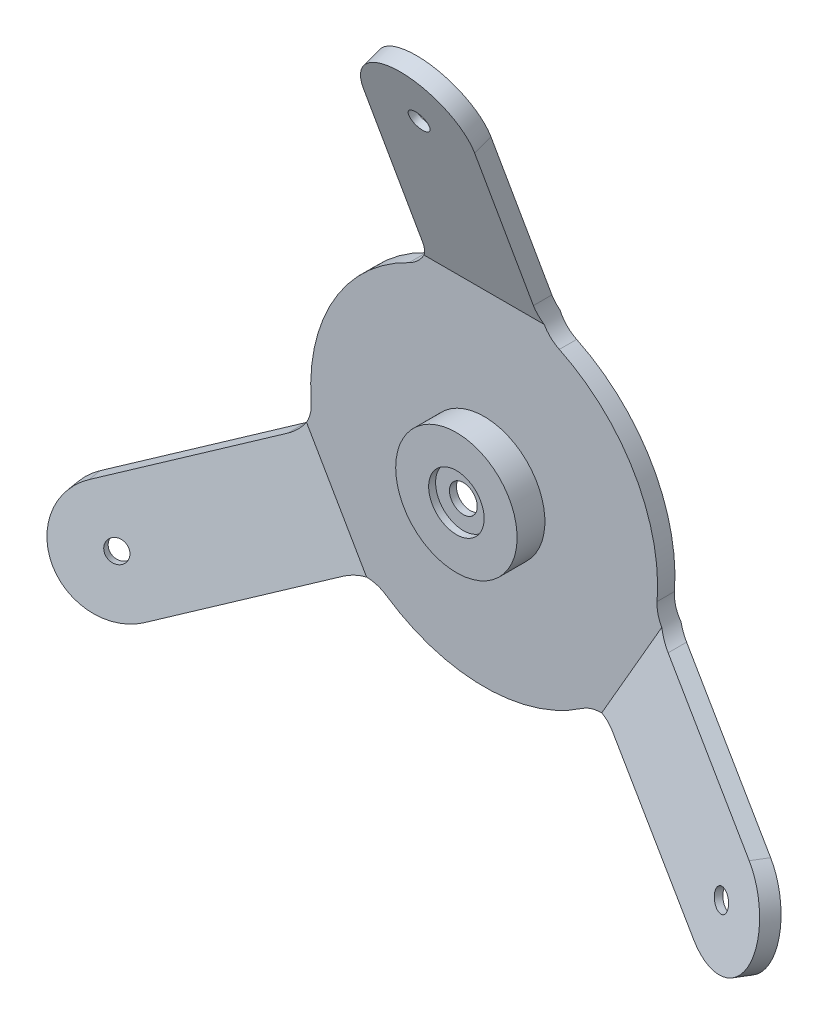
from build123d import *

# Parameters (mm, degrees)
SKETCH_1_R                       = 50
EXTRUDE_1_DEPTH                  = 5
SKETCH_1_3_R                     = 17.500000000000004
EXTRUDE_2_DEPTH                  = 13
SKETCH_2_R                       = 8
CUT_EXTRUDE_1_DEPTH              = 2
EXTRUDE_3_DEPTH                  = 5
EXTRUDE_5_REACH                  = 128.152
CUT_EXTRUDE_2_DEPTH              = 118.90068634817568
FILLET_5_R                       = 10
PATTERN_CIRCULAR_5_COUNT         = 3
FILLET_5_OF_PATTERN_CIRCULAR_5_R = 10
SHELL_1_T                        = -2
SKETCH_6_R                       = 3.000000000000001
CUT_EXTRUDE_3_DEPTH              = 159.93487100427444
PATTERN_CIRCULAR_6_COUNT         = 3
SKETCH_7_R                       = 4
CUT_EXTRUDE_4_DEPTH              = 158.79466820588078


with BuildPart() as part:
    # 草图1 → 凸台-拉伸1 (new body)
    with BuildSketch(Plane.XY):
        Circle(SKETCH_1_R)
    extrude(amount=EXTRUDE_1_DEPTH)

    # 草图1<3> → 凸台-拉伸2 (add)
    with BuildSketch(Plane.XY):
        with Locations(Location((0, 0, 0), (0, 0, 180))):
            Circle(SKETCH_1_3_R)
    extrude(amount=EXTRUDE_2_DEPTH)

    # 草图2 → 切除-拉伸1 (cut)
    with BuildSketch(Plane.XY.offset(13)):
        Circle(SKETCH_2_R)
    extrude(amount=-CUT_EXTRUDE_1_DEPTH, mode=Mode.SUBTRACT)

    # 草图3 → 凸台-拉伸3 (add)
    with BuildSketch(Plane(origin=(5.065286390387326, -2.9244444610127034, -16.069690242163254), x_dir=(-0.4547694655894244, 0.8399115425669119, -0.296198132726018), z_dir=(0.2961981327260181, -0.17101007166283297, -0.9396926207859104))):
        with BuildLine():
            Line((-48.68988406746872, 9.635909059096992), (-44.170713707432306, 7.026764835216193))
            Line((-44.170713707432306, 7.026764835216193), (-28.17071370743221, 34.73957775631811))
            Line((-28.17071370743221, 34.73957775631811), (-32.68988406746857, 37.348721980198945))
            Line((-32.68988406746857, 37.348721980198945), (-80.91104144309439, 65.18922017165217))
            ThreePointArc((-80.91104144309439, 65.18922017165217), (-102.76744790364546, 59.33281371110126), (-96.91104144309453, 37.47640725055021))
            Line((-96.91104144309453, 37.47640725055021), (-48.68988406746872, 9.635909059096992))
        make_face()
    extrude_3 = extrude(amount=-EXTRUDE_3_DEPTH)

    # 凸台-拉伸5: up to this face of the body (flat: up to its plane)
    extrude_5_end = Plane(part.part.faces().sort_by_distance((41.313007094, -23.852075767, 5))[0])
    # 草图3<3> → 凸台-拉伸5 (add, up to the picked face)
    with BuildSketch(Plane(origin=(5.065286390387326, -2.9244444610127034, -16.069690242163254), x_dir=(-0.4547694655894244, 0.8399115425669119, -0.296198132726018), z_dir=(0.2961981327260181, -0.17101007166283297, -0.9396926207859104)), mode=Mode.PRIVATE) as extrude_5_sk1:
        with BuildLine():
            Line((-48.68988406746872, 9.635909059096992), (-44.170713707432306, 7.026764835216193))
            Line((-44.170713707432306, 7.026764835216193), (-28.17071370743221, 34.73957775631811))
            Line((-28.17071370743221, 34.73957775631811), (-32.68988406746857, 37.348721980198945))
            Line((-32.68988406746857, 37.348721980198945), (-80.91104144309439, 65.18922017165217))
            ThreePointArc((-80.91104144309439, 65.18922017165217), (-102.76744790364546, 59.33281371110126), (-96.91104144309453, 37.47640725055021))
            Line((-96.91104144309453, 37.47640725055021), (-48.68988406746872, 9.635909059096992))
        make_face()
    extrude_5_tool1 = split(extrude(extrude_5_sk1.sketch, amount=-EXTRUDE_5_REACH, mode=Mode.PRIVATE), bisect_by=extrude_5_end, keep=Keep.BOTH, mode=Mode.PRIVATE)
    extrude_5 = extrude_5_tool1.solids().sort_by(Axis((69.018363, -39.847771, 10.808293), (-0.2961981327260181, 0.17101007166283297, 0.9396926207859104)))[0]
    add(extrude_5)

    # 草图5 → 切除-拉伸2 (cut, through all)
    with BuildSketch(Plane(origin=(38.49206954203913, -22.223406711762383, -1.6037e-13), x_dir=(-3.05e-15, 1.78e-15, -1), z_dir=(0.8660254037844358, -0.5000000000000049, -3.5322521134775243e-15))):
        Polygon((-1.648e-13, 16.000000000000025), (-1.5959e-13, -15.999999999999938), (1.784759762817917, -15.999999999999941), (1.7847597628179104, 16.00000000000001), align=None)
    cut_extrude_2 = extrude(amount=CUT_EXTRUDE_2_DEPTH, mode=Mode.SUBTRACT)

    # 圆角5
    # the kernel refuses this fillet: 10 mm, written as the material it adds along each edge
    with BuildSketch(Plane(origin=(49.02438299353199, -9.829032104103193, 21.757865522686952), x_dir=(0.13621517176222497, 0.9906792755386516, 2.0677653492524378e-13), z_dir=(-1.421e-14, 2.1068e-13, -1))) as fillet_5_piece_1_section:
        with BuildLine():
            CenterArc((6.731018039103729, 9.981260704815702), FILLET_5_R, 202.17110675219934, 64.32071138054346)
            Line((-2.5295920158997607, 6.207522318391934), (0, 0))
            ThreePointArc((0, 0), (3.059553654138056, 0.09369647592149925), (6.119107308276114, -4e-17))
        make_face()
    fillet_5_piece_1 = extrude(amount=21.757865522686952, mode=Mode.PRIVATE)
    fillet_5_piece_1 = split(fillet_5_piece_1, bisect_by=Plane(origin=(52.84730831811883, -11.940665679476957, 5), z_dir=(0, 0, 1)), keep=Keep.TOP, mode=Mode.PRIVATE)
    fillet_5_piece_1 = split(fillet_5_piece_1, bisect_by=Plane(origin=(52.714644452393756, -11.864072160888846, 5.897511373073815), z_dir=(0.2961981327260181, -0.17101007166283302, -0.9396926207859104)), keep=Keep.TOP, mode=Mode.PRIVATE)
    add(fillet_5_piece_1)
    with BuildSketch(Plane(origin=(49.02438299353206, -9.829032104104291, 5), x_dir=(0.13621517176219033, 0.9906792755386564, 2.067765349252453e-13), z_dir=(-1.421e-14, 2.1068e-13, -1))) as fillet_5_piece_2_section:
        with BuildLine():
            CenterArc((6.731018039104405, 9.981260704815725), FILLET_5_R, 202.17110675220147, 64.32071138054334)
            Line((-2.5295920158989453, 6.20752231839161), (0, 0))
            ThreePointArc((0, 0), (3.059553654138554, 0.09369647592138662), (6.119107308277147, 7e-17))
        make_face()
    fillet_5_piece_2 = extrude(amount=5, mode=Mode.PRIVATE)
    fillet_5_piece_2 = split(fillet_5_piece_2, bisect_by=Plane(origin=(49.82758960271088, -7.64578575322723, 4.219824774764975), z_dir=(-0.2961981327260181, 0.17101007166283302, 0.9396926207859104)), keep=Keep.TOP, mode=Mode.PRIVATE)
    add(fillet_5_piece_2)
    with BuildSketch(Plane(origin=(49.02438299353206, -9.829032104104291, 5), x_dir=(0.13621517176219033, 0.9906792755386564, 2.067765349252453e-13), z_dir=(-1.421e-14, 2.1068e-13, -1))) as fillet_5_piece_3_section:
        with BuildLine():
            CenterArc((6.731018039104405, 9.981260704815725), FILLET_5_R, 202.17110675220147, 64.32071138054334)
            Line((-2.5295920158989453, 6.20752231839161), (0, 0))
            ThreePointArc((0, 0), (3.059553654138554, 0.09369647592138662), (6.119107308277147, 7e-17))
        make_face()
    fillet_5_piece_3 = extrude(amount=5, mode=Mode.PRIVATE)
    fillet_5_piece_3 = split(fillet_5_piece_3, bisect_by=Plane(origin=(51.376248958655296, -9.84493274720883, -0.2127030682430071), z_dir=(-0.2961981327260181, 0.17101007166283302, 0.9396926207859104)), keep=Keep.TOP, mode=Mode.PRIVATE)
    fillet_5_piece_3 = split(fillet_5_piece_3, bisect_by=Plane(origin=(49.8952582950252, -8.98988238889466, 4.485760035686546), z_dir=(0.2961981327260181, -0.17101007166283302, -0.9396926207859104)), keep=Keep.TOP, mode=Mode.PRIVATE)
    add(fillet_5_piece_3)
    with BuildSketch(Plane(origin=(33.02438299353184, -37.54184502520521, 0), x_dir=(-0.7898458337381293, -0.6133054368962657, 7.566603122460955e-14), z_dir=(6.821e-14, 3.553e-14, 1))) as fillet_5_piece_4_section:
        with BuildLine():
            CenterArc((6.731018039103674, 9.981260704815702), FILLET_5_R, 202.17110675219942, 64.32071138054346)
            Line((-2.529592015899812, 6.20752231839192), (0, 0))
            ThreePointArc((0, 0), (3.059553654138055, 0.0936964759214936), (6.119107308276071, -1.7e-16))
        make_face()
    fillet_5_piece_4 = extrude(amount=5, mode=Mode.PRIVATE)
    fillet_5_piece_4 = split(fillet_5_piece_4, bisect_by=Plane(origin=(32.73309567333404, -38.71562001742838, 4.485760035687541), z_dir=(0.2961981327260181, -0.17101007166283302, -0.9396926207859104)), keep=Keep.TOP, mode=Mode.PRIVATE)
    fillet_5_piece_4 = split(fillet_5_piece_4, bisect_by=Plane(origin=(34.21408633696413, -39.570670375742544, -0.21270306824201057), z_dir=(-0.2961981327260181, 0.17101007166283302, 0.9396926207859104)), keep=Keep.TOP, mode=Mode.PRIVATE)
    add(fillet_5_piece_4)
    with BuildSketch(Plane(origin=(33.02438299353184, -37.54184502520521, 0), x_dir=(-0.7898458337381293, -0.6133054368962657, 7.566603122460955e-14), z_dir=(6.821e-14, 3.553e-14, 1))) as fillet_5_piece_5_section:
        with BuildLine():
            CenterArc((6.731018039103674, 9.981260704815702), FILLET_5_R, 202.17110675219942, 64.32071138054346)
            Line((-2.529592015899812, 6.20752231839192), (0, 0))
            ThreePointArc((0, 0), (3.059553654138055, 0.0936964759214936), (6.119107308276071, -1.7e-16))
        make_face()
    fillet_5_piece_5 = extrude(amount=21.757865522687496, mode=Mode.PRIVATE)
    fillet_5_piece_5 = split(fillet_5_piece_5, bisect_by=Plane(origin=(36.764573975586906, -39.7967786853785, 5), z_dir=(0, 0, 1)), keep=Keep.TOP, mode=Mode.PRIVATE)
    fillet_5_piece_5 = split(fillet_5_piece_5, bisect_by=Plane(origin=(36.63191010986169, -39.720185166790316, 5.897511373074433), z_dir=(0.2961981327260181, -0.17101007166283302, -0.9396926207859104)), keep=Keep.TOP, mode=Mode.PRIVATE)
    add(fillet_5_piece_5)
    with BuildSketch(Plane(origin=(33.02438299353184, -37.54184502520521, 0), x_dir=(-0.7898458337381293, -0.6133054368962657, 7.566603122460955e-14), z_dir=(6.821e-14, 3.553e-14, 1))) as fillet_5_piece_6_section:
        with BuildLine():
            CenterArc((6.731018039103674, 9.981260704815702), FILLET_5_R, 202.17110675219942, 64.32071138054346)
            Line((-2.529592015899812, 6.20752231839192), (0, 0))
            ThreePointArc((0, 0), (3.059553654138055, 0.0936964759214936), (6.119107308276071, -1.7e-16))
        make_face()
    fillet_5_piece_6 = extrude(amount=5, mode=Mode.PRIVATE)
    fillet_5_piece_6 = split(fillet_5_piece_6, bisect_by=Plane(origin=(31.535239495546648, -39.3290655286776, 4.2198247747657565), z_dir=(-0.2961981327260181, 0.17101007166283302, 0.9396926207859104)), keep=Keep.TOP, mode=Mode.PRIVATE)
    add(fillet_5_piece_6)

    # 阵列(圆周)5: 凸台-拉伸3, 凸台-拉伸5, 切除-拉伸2 ×3 about axis
    pattern_circular_5_axis = Axis((-1.19e-15, 4.01e-15, 0), (0, 0, 1))
    add([extrude_3.rotate(pattern_circular_5_axis, i * 360 / PATTERN_CIRCULAR_5_COUNT) for i in range(1, PATTERN_CIRCULAR_5_COUNT)])
    add([extrude_5.rotate(pattern_circular_5_axis, i * 360 / PATTERN_CIRCULAR_5_COUNT) for i in range(1, PATTERN_CIRCULAR_5_COUNT)])
    add([cut_extrude_2.rotate(pattern_circular_5_axis, i * 360 / PATTERN_CIRCULAR_5_COUNT) for i in range(1, PATTERN_CIRCULAR_5_COUNT)], mode=Mode.SUBTRACT)

    # 圆角5 of 阵列(圆周)5
    # the kernel refuses this fillet: 10 mm, written as the material it adds along each edge
    with BuildSketch(Plane(origin=(-15.999999999999766, 47.37087712930813, 0), x_dir=(-0.9260610055003486, -0.37737383864237767, -1.556384909056303e-13), z_dir=(-1.3216e-13, -8.811e-14, 1))) as fillet_5_of_pattern_circular_5_piece_1_section:
        with BuildLine():
            CenterArc((6.731018039103714, -9.981260704815698), FILLET_5_OF_PATTERN_CIRCULAR_5_R, 93.5081818672572, 64.3207113805434)
            Line((-2.529592015899774, -6.207522318391922), (0, 0))
            ThreePointArc((0, 0), (3.0595536541380572, -0.09369647592149477), (6.119107308276103, -1e-17))
        make_face()
    fillet_5_of_pattern_circular_5_piece_1 = extrude(amount=5, mode=Mode.PRIVATE)
    fillet_5_of_pattern_circular_5_piece_1 = split(fillet_5_of_pattern_circular_5_piece_1, bisect_by=Plane(origin=(-17.162162621694545, 49.41560312295407, -0.21270306824287744), z_dir=(-1.7763568394002505e-15, -0.3420201433256631, 0.9396926207859105)), keep=Keep.TOP, mode=Mode.PRIVATE)
    fillet_5_of_pattern_circular_5_piece_1 = split(fillet_5_of_pattern_circular_5_piece_1, bisect_by=Plane(origin=(-17.162162621694556, 47.70550240632575, 4.485760035686674), z_dir=(1.7763568394002505e-15, 0.3420201433256631, -0.9396926207859105)), keep=Keep.TOP, mode=Mode.PRIVATE)
    add(fillet_5_of_pattern_circular_5_piece_1)
    with BuildSketch(Plane(origin=(-15.999999999999766, 47.37087712930813, 0), x_dir=(-0.9260610055003486, -0.37737383864237767, -1.556384909056303e-13), z_dir=(-1.3216e-13, -8.811e-14, 1))) as fillet_5_of_pattern_circular_5_piece_2_section:
        with BuildLine():
            CenterArc((6.731018039103714, -9.981260704815698), FILLET_5_OF_PATTERN_CIRCULAR_5_R, 93.5081818672572, 64.3207113805434)
            Line((-2.529592015899774, -6.207522318391922), (0, 0))
            ThreePointArc((0, 0), (3.0595536541380572, -0.09369647592149477), (6.119107308276103, -1e-17))
        make_face()
    fillet_5_of_pattern_circular_5_piece_2 = extrude(amount=21.75786552268825, mode=Mode.PRIVATE)
    fillet_5_of_pattern_circular_5_piece_2 = split(fillet_5_of_pattern_circular_5_piece_2, bisect_by=Plane(origin=(-16.08273434253529, 51.73744436485874, 5), z_dir=(0, 0, 1)), keep=Keep.TOP, mode=Mode.PRIVATE)
    fillet_5_of_pattern_circular_5_piece_2 = split(fillet_5_of_pattern_circular_5_piece_2, bisect_by=Plane(origin=(-16.082734342535286, 51.58425732768241, 5.897511373074018), z_dir=(1.7763568394002505e-15, 0.3420201433256631, -0.9396926207859105)), keep=Keep.TOP, mode=Mode.PRIVATE)
    add(fillet_5_of_pattern_circular_5_piece_2)
    with BuildSketch(Plane(origin=(-15.999999999999766, 47.37087712930813, 0), x_dir=(-0.9260610055003486, -0.37737383864237767, -1.556384909056303e-13), z_dir=(-1.3216e-13, -8.811e-14, 1))) as fillet_5_of_pattern_circular_5_piece_3_section:
        with BuildLine():
            CenterArc((6.731018039103714, -9.981260704815698), FILLET_5_OF_PATTERN_CIRCULAR_5_R, 93.5081818672572, 64.3207113805434)
            Line((-2.529592015899774, -6.207522318391922), (0, 0))
            ThreePointArc((0, 0), (3.0595536541380572, -0.09369647592149477), (6.119107308276103, -1e-17))
        make_face()
    fillet_5_of_pattern_circular_5_piece_3 = extrude(amount=5, mode=Mode.PRIVATE)
    fillet_5_of_pattern_circular_5_piece_3 = split(fillet_5_of_pattern_circular_5_piece_3, bisect_by=Plane(origin=(-18.29235010716722, 46.974851281906425, 4.219824774764913), z_dir=(-1.7763568394002505e-15, -0.3420201433256631, 0.9396926207859105)), keep=Keep.TOP, mode=Mode.PRIVATE)
    add(fillet_5_of_pattern_circular_5_piece_3)
    with BuildSketch(Plane(origin=(16.000000000000224, 47.37087712930797, 0), x_dir=(9.54e-15, 1, -1.4495e-13), z_dir=(-2.1458e-13, 1.4495e-13, 1))) as fillet_5_of_pattern_circular_5_piece_4_section:
        with BuildLine():
            CenterArc((6.703146209075082, -10), FILLET_5_OF_PATTERN_CIRCULAR_5_R, 89.99999999999997, 64.3207113805434)
            ThreePointArc((-2.309191013988783, -5.666666666666704), (-1.0678268542906946, -2.868691932119112), (0, 0))
            Line((0, 0), (6.703146209075086, 0))
        make_face()
    fillet_5_of_pattern_circular_5_piece_4 = extrude(amount=5, mode=Mode.PRIVATE)
    fillet_5_of_pattern_circular_5_piece_4 = split(fillet_5_of_pattern_circular_5_piece_4, bisect_by=Plane(origin=(17.162162621235485, 49.41560312244018, -0.2127030684298532), z_dir=(-1.7763568394002505e-15, -0.3420201433256631, 0.9396926207859105)), keep=Keep.TOP, mode=Mode.PRIVATE)
    fillet_5_of_pattern_circular_5_piece_4 = split(fillet_5_of_pattern_circular_5_piece_4, bisect_by=Plane(origin=(17.162162621235474, 47.70550240581186, 4.485760035499698), z_dir=(1.7763568394002505e-15, 0.3420201433256631, -0.9396926207859105)), keep=Keep.TOP, mode=Mode.PRIVATE)
    add(fillet_5_of_pattern_circular_5_piece_4)
    with BuildSketch(Plane(origin=(16.000000000000224, 47.37087712930797, 0), x_dir=(9.54e-15, 1, -1.4495e-13), z_dir=(-2.1458e-13, 1.4495e-13, 1))) as fillet_5_of_pattern_circular_5_piece_5_section:
        with BuildLine():
            CenterArc((6.703146209075082, -10), FILLET_5_OF_PATTERN_CIRCULAR_5_R, 89.99999999999997, 64.3207113805434)
            ThreePointArc((-2.309191013988783, -5.666666666666704), (-1.0678268542906946, -2.868691932119112), (0, 0))
            Line((0, 0), (6.703146209075086, 0))
        make_face()
    fillet_5_of_pattern_circular_5_piece_5 = extrude(amount=5, mode=Mode.PRIVATE)
    fillet_5_of_pattern_circular_5_piece_5 = split(fillet_5_of_pattern_circular_5_piece_5, bisect_by=Plane(origin=(18.292350106036324, 46.974851281356855, 4.219824774564952), z_dir=(-1.7763568394002505e-15, -0.3420201433256631, 0.9396926207859105)), keep=Keep.TOP, mode=Mode.PRIVATE)
    add(fillet_5_of_pattern_circular_5_piece_5)
    with BuildSketch(Plane(origin=(16.000000000000224, 47.37087712930797, 0), x_dir=(9.54e-15, 1, -1.4495e-13), z_dir=(-2.1458e-13, 1.4495e-13, 1))) as fillet_5_of_pattern_circular_5_piece_6_section:
        with BuildLine():
            CenterArc((6.703146209075082, -10), FILLET_5_OF_PATTERN_CIRCULAR_5_R, 89.99999999999997, 64.3207113805434)
            ThreePointArc((-2.309191013988783, -5.666666666666704), (-1.0678268542906946, -2.868691932119112), (0, 0))
            Line((0, 0), (6.703146209075086, 0))
        make_face()
    fillet_5_of_pattern_circular_5_piece_6 = extrude(amount=21.757865522686828, mode=Mode.PRIVATE)
    fillet_5_of_pattern_circular_5_piece_6 = split(fillet_5_of_pattern_circular_5_piece_6, bisect_by=Plane(origin=(16.082734343372024, 51.7374443634232, 5), z_dir=(0, 0, 1)), keep=Keep.TOP, mode=Mode.PRIVATE)
    fillet_5_of_pattern_circular_5_piece_6 = split(fillet_5_of_pattern_circular_5_piece_6, bisect_by=Plane(origin=(16.082734343372035, 51.58425732627241, 5.897511372560881), z_dir=(1.7763568394002505e-15, 0.3420201433256631, -0.9396926207859105)), keep=Keep.TOP, mode=Mode.PRIVATE)
    add(fillet_5_of_pattern_circular_5_piece_6)
    with BuildSketch(Plane(origin=(-33.024382993532214, -37.54184502520488, 21.757865522688395), x_dir=(0.7898458337381224, -0.6133054368962745, -1.9097417521666665e-13), z_dir=(-1.7337e-13, 8.811e-14, -1))) as fillet_5_of_pattern_circular_5_piece_7_section:
        with BuildLine():
            CenterArc((6.731018039103731, 9.981260704815696), FILLET_5_OF_PATTERN_CIRCULAR_5_R, 202.1711067521994, 64.32071138054334)
            Line((-2.529592015899754, 6.207522318391921), (0, 0))
            ThreePointArc((0, 0), (3.059553654138052, 0.09369647592148923), (6.11910730827611, -2.4e-16))
        make_face()
    fillet_5_of_pattern_circular_5_piece_7 = extrude(amount=21.757865522688395, mode=Mode.PRIVATE)
    fillet_5_of_pattern_circular_5_piece_7 = split(fillet_5_of_pattern_circular_5_piece_7, bisect_by=Plane(origin=(-36.76457397558818, -39.79677868537744, 5), z_dir=(0, 0, 1)), keep=Keep.TOP, mode=Mode.PRIVATE)
    fillet_5_of_pattern_circular_5_piece_7 = split(fillet_5_of_pattern_circular_5_piece_7, bisect_by=Plane(origin=(-36.63191010986293, -39.720185166789236, 5.897511373074565), z_dir=(-0.2961981327260199, -0.17101007166282992, -0.9396926207859104)), keep=Keep.TOP, mode=Mode.PRIVATE)
    add(fillet_5_of_pattern_circular_5_piece_7)
    with BuildSketch(Plane(origin=(-33.02438299353139, -37.541845025205276, 5), x_dir=(0.7898458337381034, -0.613305436896299, -1.909741752166655e-13), z_dir=(-1.7337e-13, 8.811e-14, -1))) as fillet_5_of_pattern_circular_5_piece_8_section:
        with BuildLine():
            CenterArc((6.7310180391030885, 9.981260704815686), FILLET_5_OF_PATTERN_CIRCULAR_5_R, 202.17110675219766, 64.32071138054334)
            Line((-2.5295920159005125, 6.207522318392188), (0, 0))
            ThreePointArc((0, 0), (3.059553654137562, 0.09369647592158793), (6.1191073082751695, 3.7e-16))
        make_face()
    fillet_5_of_pattern_circular_5_piece_8 = extrude(amount=5, mode=Mode.PRIVATE)
    fillet_5_of_pattern_circular_5_piece_8 = split(fillet_5_of_pattern_circular_5_piece_8, bisect_by=Plane(origin=(-31.53523949554797, -39.329065528676885, 4.21982477476597), z_dir=(0.2961981327260199, 0.17101007166282992, 0.9396926207859104)), keep=Keep.TOP, mode=Mode.PRIVATE)
    add(fillet_5_of_pattern_circular_5_piece_8)
    with BuildSketch(Plane(origin=(-33.02438299353139, -37.541845025205276, 5), x_dir=(0.7898458337381034, -0.613305436896299, -1.909741752166655e-13), z_dir=(-1.7337e-13, 8.811e-14, -1))) as fillet_5_of_pattern_circular_5_piece_9_section:
        with BuildLine():
            CenterArc((6.7310180391030885, 9.981260704815686), FILLET_5_OF_PATTERN_CIRCULAR_5_R, 202.17110675219766, 64.32071138054334)
            Line((-2.5295920159005125, 6.207522318392188), (0, 0))
            ThreePointArc((0, 0), (3.059553654137562, 0.09369647592158793), (6.1191073082751695, 3.7e-16))
        make_face()
    fillet_5_of_pattern_circular_5_piece_9 = extrude(amount=5, mode=Mode.PRIVATE)
    fillet_5_of_pattern_circular_5_piece_9 = split(fillet_5_of_pattern_circular_5_piece_9, bisect_by=Plane(origin=(-34.2140863369662, -39.5706703757415, -0.21270306824161445), z_dir=(0.2961981327260199, 0.17101007166282992, 0.9396926207859104)), keep=Keep.TOP, mode=Mode.PRIVATE)
    fillet_5_of_pattern_circular_5_piece_9 = split(fillet_5_of_pattern_circular_5_piece_9, bisect_by=Plane(origin=(-32.7330956733361, -38.71562001742734, 4.485760035687935), z_dir=(-0.2961981327260199, -0.17101007166282992, -0.9396926207859104)), keep=Keep.TOP, mode=Mode.PRIVATE)
    add(fillet_5_of_pattern_circular_5_piece_9)
    with BuildSketch(Plane(origin=(-49.02438299353208, -9.829032104102753, 0), x_dir=(-0.13621517176221587, 0.9906792755386528, 2.1397412113202394e-13), z_dir=(-1.563e-14, -2.1814e-13, 1))) as fillet_5_of_pattern_circular_5_piece_10_section:
        with BuildLine():
            CenterArc((6.731018039103715, 9.9812607048157), FILLET_5_OF_PATTERN_CIRCULAR_5_R, 202.1711067521994, 64.3207113805434)
            Line((-2.529592015899774, 6.207522318391925), (0, 0))
            ThreePointArc((0, 0), (3.05955365413807, 0.09369647592149644), (6.119107308276103, -1e-17))
        make_face()
    fillet_5_of_pattern_circular_5_piece_10 = extrude(amount=5, mode=Mode.PRIVATE)
    fillet_5_of_pattern_circular_5_piece_10 = split(fillet_5_of_pattern_circular_5_piece_10, bisect_by=Plane(origin=(-49.89525829502565, -8.989882388902053, 4.485760035688095), z_dir=(-0.2961981327260199, -0.17101007166282992, -0.9396926207859104)), keep=Keep.TOP, mode=Mode.PRIVATE)
    fillet_5_of_pattern_circular_5_piece_10 = split(fillet_5_of_pattern_circular_5_piece_10, bisect_by=Plane(origin=(-51.376248958655744, -9.844932747216212, -0.21270306824145635), z_dir=(0.2961981327260199, 0.17101007166282992, 0.9396926207859104)), keep=Keep.TOP, mode=Mode.PRIVATE)
    add(fillet_5_of_pattern_circular_5_piece_10)
    with BuildSketch(Plane(origin=(-49.02438299353208, -9.829032104102753, 0), x_dir=(-0.13621517176221587, 0.9906792755386528, 2.1397412113202394e-13), z_dir=(-1.563e-14, -2.1814e-13, 1))) as fillet_5_of_pattern_circular_5_piece_11_section:
        with BuildLine():
            CenterArc((6.731018039103715, 9.9812607048157), FILLET_5_OF_PATTERN_CIRCULAR_5_R, 202.1711067521994, 64.3207113805434)
            Line((-2.529592015899774, 6.207522318391925), (0, 0))
            ThreePointArc((0, 0), (3.05955365413807, 0.09369647592149644), (6.119107308276103, -1e-17))
        make_face()
    fillet_5_of_pattern_circular_5_piece_11 = extrude(amount=21.75786552268695, mode=Mode.PRIVATE)
    fillet_5_of_pattern_circular_5_piece_11 = split(fillet_5_of_pattern_circular_5_piece_11, bisect_by=Plane(origin=(-52.8473083181177, -11.940665679483903, 5), z_dir=(0, 0, 1)), keep=Keep.TOP, mode=Mode.PRIVATE)
    fillet_5_of_pattern_circular_5_piece_11 = split(fillet_5_of_pattern_circular_5_piece_11, bisect_by=Plane(origin=(-52.714644452392434, -11.864072160895685, 5.8975113730747015), z_dir=(-0.2961981327260199, -0.17101007166282992, -0.9396926207859104)), keep=Keep.TOP, mode=Mode.PRIVATE)
    add(fillet_5_of_pattern_circular_5_piece_11)
    with BuildSketch(Plane(origin=(-49.02438299353208, -9.829032104102753, 0), x_dir=(-0.13621517176221587, 0.9906792755386528, 2.1397412113202394e-13), z_dir=(-1.563e-14, -2.1814e-13, 1))) as fillet_5_of_pattern_circular_5_piece_12_section:
        with BuildLine():
            CenterArc((6.731018039103715, 9.9812607048157), FILLET_5_OF_PATTERN_CIRCULAR_5_R, 202.1711067521994, 64.3207113805434)
            Line((-2.529592015899774, 6.207522318391925), (0, 0))
            ThreePointArc((0, 0), (3.05955365413807, 0.09369647592149644), (6.119107308276103, -1e-17))
        make_face()
    fillet_5_of_pattern_circular_5_piece_12 = extrude(amount=5, mode=Mode.PRIVATE)
    fillet_5_of_pattern_circular_5_piece_12 = split(fillet_5_of_pattern_circular_5_piece_12, bisect_by=Plane(origin=(-49.827589602711555, -7.6457857532330955, 4.219824774766323), z_dir=(0.2961981327260199, 0.17101007166282992, 0.9396926207859104)), keep=Keep.TOP, mode=Mode.PRIVATE)
    add(fillet_5_of_pattern_circular_5_piece_12)

    # 抽壳1
    shell_1_openings = [part.faces().sort_by_distance(p)[0] for p in [
        (0, 0, 0),
        (-71.116705323, -41.059248962, 11.690177214),
        (0, 82.118497924, 11.690177214),
        (71.116705323, -41.059248962, 11.690177214),
    ]]
    offset(amount=SHELL_1_T, openings=shell_1_openings, kind=Kind.INTERSECTION)

    # 草图6 → 切除-拉伸3 (cut, through all)
    with BuildSketch(Plane(origin=(5.878e-14, 4.1387882053970415, -11.371227138233701), x_dir=(1, -1.66e-15, 4.56e-15), z_dir=(-4.85722573273506e-15, -0.34202014332566305, 0.9396926207859105))):
        with Locations(Location((1.36037e-12, 102.66562742220144, 0), (0, 0, 270))):
            Circle(SKETCH_6_R)
    cut_extrude_3 = extrude(amount=-CUT_EXTRUDE_3_DEPTH, mode=Mode.SUBTRACT)

    # 阵列(圆周)6: 切除-拉伸3 ×3 about axis
    pattern_circular_6_axis = Axis((0, 0, 13), (0, 0, -1))
    for i in range(1, PATTERN_CIRCULAR_6_COUNT):
        add(cut_extrude_3.rotate(pattern_circular_6_axis, i * 360 / PATTERN_CIRCULAR_6_COUNT), mode=Mode.SUBTRACT)

    # 草图7 → 切除-拉伸4 (cut, through all)
    with BuildSketch(Plane.XY.offset(11)):
        Circle(SKETCH_7_R)
    extrude(amount=-CUT_EXTRUDE_4_DEPTH, mode=Mode.SUBTRACT)


solid = part.part
